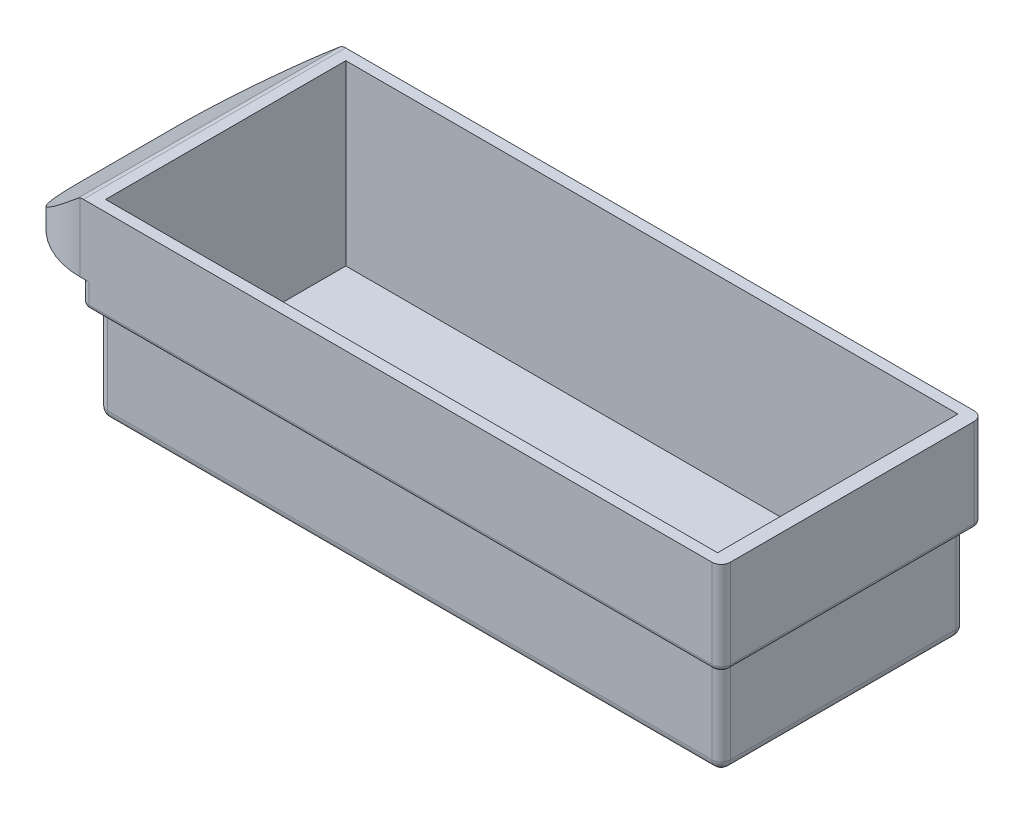
from build123d import *

# Parameters (mm, degrees)
SKETCH1_W           = 139.7
SKETCH1_H           = 57.15
BOSS_EXTRUDE1_DEPTH = 20.32
SKETCH2_W           = 135.7
SKETCH2_H           = 53.15
BOSS_EXTRUDE2_DEPTH = 20.955
BOSS_EXTRUDE3_DEPTH = 57.15
CUT_EXTRUDE1_DEPTH  = 96.931280842
FILLET1_R           = 2
FILLET2_R           = 1
SKETCH5_W           = 133.35
SKETCH5_H           = 52.35
CUT_EXTRUDE2_DEPTH  = 38.735


with BuildPart() as part:
    # Sketch1 → Boss-Extrude1 (new body)
    with BuildSketch(Plane(origin=(0, 0, 0), x_dir=(1, 0, 0), z_dir=(0, 1, 0))):
        Rectangle(SKETCH1_W, SKETCH1_H)
    extrude(amount=BOSS_EXTRUDE1_DEPTH)

    # Sketch2 → Boss-Extrude2 (add)
    with BuildSketch(Plane.XZ):
        Rectangle(SKETCH2_W, SKETCH2_H)
    extrude(amount=BOSS_EXTRUDE2_DEPTH)

    # Sketch3 → Boss-Extrude3 (add, through all)
    with BuildSketch(Plane.XY.offset(28.575)):
        Polygon((-69.85, 20.32), (-87.726303889, 5.32), (-69.85, 5.32), align=None)
    extrude(amount=-BOSS_EXTRUDE3_DEPTH)

    # Sketch4 → Cut-Extrude1 (cut, through all)
    with BuildSketch(Plane.XZ.offset(-5.32)):
        with BuildLine():
            Line((-69.85, -28.575), (-87.726303889, -28.575))
            Line((-87.726303889, -28.575), (-87.726303889, -10.698696111))
            ThreePointArc((-87.726303889, -10.698696111), (-82.490455702, -23.339151813), (-69.85, -28.575))
        make_face()
        with BuildLine():
            Line((-87.726303889, 10.698696111), (-87.726303889, 28.575))
            Line((-87.726303889, 28.575), (-69.85, 28.575))
            ThreePointArc((-69.85, 28.575), (-82.490455702, 23.339151813), (-87.726303889, 10.698696111))
        make_face()
    extrude(amount=-CUT_EXTRUDE1_DEPTH, mode=Mode.SUBTRACT)

    # Fillet1
    fillet1_edges = [part.edges().sort_by_distance(p)[0] for p in [
        (-69.85, 20.32, 0),
        (-69.85, 2.66, -28.575),
        (-67.85, -10.4775, -26.575),
        (69.85, 10.16, -28.575),
        (67.85, -10.4775, -26.575),
        (69.85, 10.16, 28.575),
        (67.85, -10.4775, 26.575),
        (-67.85, -10.4775, 26.575),
        (-69.85, 2.66, 28.575),
        (-67.85, -20.955, 0),
        (0, -20.955, 26.575),
        (67.85, -20.955, 0),
        (0, -20.955, -26.575),
    ]]
    fillet(fillet1_edges, radius=FILLET1_R)

    # Fillet2
    fillet2_edges = [part.edges().sort_by_distance(p)[0] for p in [
        (0, 0, 28.575),
        (0, 0, -28.575),
        (-67.85, 0, 0),
        (0, 0, 26.575),
        (67.85, 0, 0),
        (0, 0, -26.575),
        (-69.85, 0, 0),
        (69.85, 0, 0),
        (-69.264213562, 0, 27.989213562),
        (69.264213562, 0, 27.989213562),
        (69.264213562, 0, -27.989213562),
        (-69.264213562, 0, -27.989213562),
        (-67.264213562, 0, -25.989213562),
        (67.264213562, 0, -25.989213562),
        (67.264213562, 0, 25.989213562),
        (-67.264213562, 0, 25.989213562),
    ]]
    fillet(fillet2_edges, radius=FILLET2_R - 0.0001)  # a hair under: the kernel refuses the full size

    # Sketch5 → Cut-Extrude2 (cut)
    with BuildSketch(Plane(origin=(0, 20.32, 0), x_dir=(1, 0, 0), z_dir=(0, 1, 0))):
        Rectangle(SKETCH5_W, SKETCH5_H)
    extrude(amount=-CUT_EXTRUDE2_DEPTH, mode=Mode.SUBTRACT)


solid = part.part
